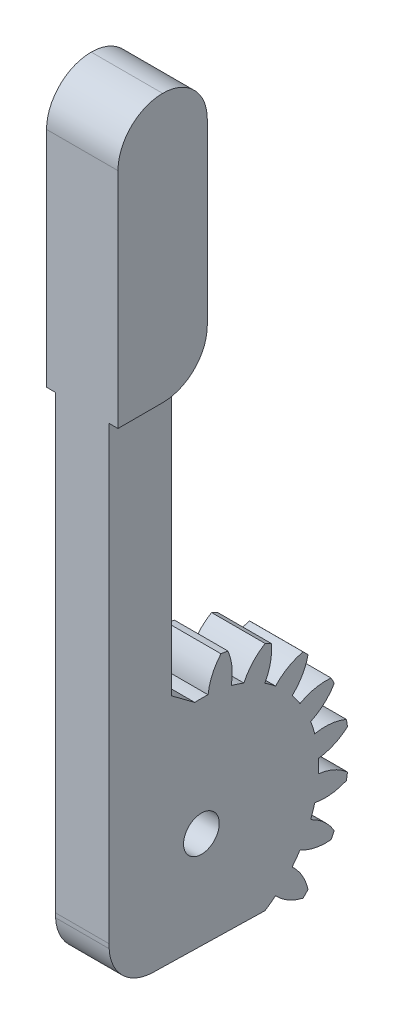
from build123d import *

# Parameters (mm, degrees)
BASPROSKE_W         = 6
BASPROSKE_H         = 16.5
TOOTHCUT_DEPTH      = 25.093567606
TEETHCUTS_COUNT     = 20
TEETHCUTS_ANGLE     = 342
BORSKE_R            = 2
BORE_DEPTH          = 50.0000508
SKETCH1_W           = 14.532002023
SKETCH1_H           = 35.225661126
CUT_EXTRUDE1_DEPTH  = 5
SKETCH3_W           = 7
SKETCH3_H           = 90
BOSS_EXTRUDE2_DEPTH = 3
SKETCH4_W           = 10
SKETCH4_H           = 30
BOSS_EXTRUDE3_DEPTH = 4
FILLET1_R           = 10
FILLET4_R           = 5
FILLET5_R           = 1
CUT_EXTRUDE4_DEPTH  = 4
CUT_EXTRUDE6_DEPTH  = 4
FILLET6_R           = 5


with BuildPart() as part:
    # BasProSke → Base-Revolve (revolve)
    with BuildSketch(Plane(origin=(0, 0, 0), x_dir=(1, 0, 0), z_dir=(0, 1, 0)), mode=Mode.PRIVATE) as base_revolve_sk:
        with Locations((3, 8.25)):
            Rectangle(BASPROSKE_W, BASPROSKE_H)
    revolve(base_revolve_sk.sketch.rotate(Axis((-10, 0, 0), (1, 0, 0)), 180), axis=Axis((-10, 0, 0), (1, 0, 0)))

    # TooCutSke → ToothCut (cut, through all)
    with BuildSketch(Plane(origin=(0, 0, 0), x_dir=(0, 0, -1), z_dir=(1, 0, 0))):
        with BuildLine():
            ThreePointArc((0.74381438, 13.102904875), (0, 13.124), (-0.74381438, 13.102904875))
            ThreePointArc((-0.74381438, 13.102904875), (-1.226473103, 14.852072512), (-2.209965745, 16.376962373))
            ThreePointArc((-2.209965745, 16.376962373), (0, 16.5254), (2.209965745, 16.376962373))
            ThreePointArc((2.209965745, 16.376962373), (1.226473103, 14.852072512), (0.74381438, 13.102904875))
        make_face()
    toothcut = extrude(amount=TOOTHCUT_DEPTH, mode=Mode.SUBTRACT)

    # TeethCuts: ToothCut ×20 about axis
    teethcuts_axis = Axis((-10, 0, 0), (1, 0, 0))
    for i in range(1, TEETHCUTS_COUNT):
        add(toothcut.rotate(teethcuts_axis, i * TEETHCUTS_ANGLE / (TEETHCUTS_COUNT - 1)), mode=Mode.SUBTRACT)

    # BorSke → Bore (cut, symmetric)
    with BuildSketch(Plane(origin=(0, 0, 0), x_dir=(0, 0, -1), z_dir=(1, 0, 0))):
        with Locations(Location((0, 0, 0), (0, 0, 180))):
            Circle(BORSKE_R)
    extrude(amount=BORE_DEPTH, both=True, mode=Mode.SUBTRACT)

    # Sketch1 → Cut-Extrude1 (cut, symmetric)
    with BuildSketch(Plane(origin=(3, 0, 0), x_dir=(0, 0, -1), z_dir=(1, 0, 0))):
        with Locations((-10.60761178, 0.822467031)):
            Rectangle(SKETCH1_W, SKETCH1_H)
    extrude(amount=CUT_EXTRUDE1_DEPTH, both=True, mode=Mode.SUBTRACT)

    # Sketch3 → Boss-Extrude2 (add, symmetric)
    with BuildSketch(Plane(origin=(3, 0, 0), x_dir=(0, 0, -1), z_dir=(1, 0, 0))):
        with Locations((-6.841610769, 29.963142125)):
            Rectangle(SKETCH3_W, SKETCH3_H)
    extrude(amount=BOSS_EXTRUDE2_DEPTH, both=True)

    # Sketch4 → Boss-Extrude3 (add, symmetric)
    with BuildSketch(Plane(origin=(3, 0, 0), x_dir=(0, 0, -1), z_dir=(1, 0, 0))):
        with Locations((-5.341610769, 59.963142125)):
            Rectangle(SKETCH4_W, SKETCH4_H)
    extrude(amount=BOSS_EXTRUDE3_DEPTH, both=True)

    # Fillet1
    # the kernel refuses this fillet: 10 mm, written as the material it takes off along each edge
    with BuildSketch(Plane(origin=(29.848480035, -15.036857875, 10.341610769), x_dir=(0, 0, -1), z_dir=(-1, 0, 0))) as fillet1_piece_1:
        with BuildLine():
            CenterArc((10, -9.539392014), FILLET1_R, 107.457603124, 72.542396876)
            Line((0, -9.539392014), (-0.2, -9.539392014))
            Line((-0.2, -9.539392014), (-0.2, 0))
            Line((-0.2, 0), (0, 0.2))
            ThreePointArc((0, 0.2), (3.5, 0.2), (6.94, 0.19078784))
            Line((6.94, 0.19078784), (7, 0))
        make_face()
    extrude(amount=53.696960071, mode=Mode.SUBTRACT)

    # Fillet4
    # the kernel refuses this fillet: 5 mm, written as the material it takes off along each edge
    with BuildSketch(Plane(origin=(19.5, 44.963142125, 0.341610769), x_dir=(0, 0, 1), z_dir=(-1, 0, 0))) as fillet4_piece_1_section:
        with BuildLine():
            CenterArc((FILLET4_R, FILLET4_R), FILLET4_R, 180, 90)
            Line((0, FILLET4_R), (0, 0))
            Line((0, 0), (FILLET4_R, 0))
        make_face()
    fillet4_piece_1 = extrude(amount=33, mode=Mode.PRIVATE)
    fillet4_piece_1 = split(fillet4_piece_1, bisect_by=Plane(origin=(12.75, 45.013801365, 3.341610769), z_dir=(0, 0, 1)), keep=Keep.TOP, mode=Mode.PRIVATE)
    fillet4_piece_1 = split(fillet4_piece_1, bisect_by=Plane(origin=(6, 45.013801365, 4.050354099), z_dir=(1, 0, 0)), keep=Keep.TOP, mode=Mode.PRIVATE)
    add(fillet4_piece_1, mode=Mode.SUBTRACT)
    with BuildSketch(Plane(origin=(19.5, 44.963142125, 0.341610769), x_dir=(0, 0, 1), z_dir=(-1, 0, 0))) as fillet4_piece_2_section:
        with BuildLine():
            CenterArc((FILLET4_R, FILLET4_R), FILLET4_R, 180, 90)
            Line((0, FILLET4_R), (0, 0))
            Line((0, 0), (FILLET4_R, 0))
        make_face()
    fillet4_piece_2 = extrude(amount=33, mode=Mode.PRIVATE)
    fillet4_piece_2 = split(fillet4_piece_2, bisect_by=Plane(origin=(12.75, 46.181868003, 3.341610769), z_dir=(0, 0, -1)), keep=Keep.TOP, mode=Mode.PRIVATE)
    fillet4_piece_2 = split(fillet4_piece_2, bisect_by=Plane(origin=(6, 46.181868003, 1.266861087), z_dir=(1, 0, 0)), keep=Keep.TOP, mode=Mode.PRIVATE)
    add(fillet4_piece_2, mode=Mode.SUBTRACT)
    with BuildSketch(Plane(origin=(19.5, 44.963142125, 0.341610769), x_dir=(0, 0, 1), z_dir=(-1, 0, 0))) as fillet4_piece_3_section:
        with BuildLine():
            CenterArc((FILLET4_R, FILLET4_R), FILLET4_R, 180, 90)
            Line((0, FILLET4_R), (0, 0))
            Line((0, 0), (FILLET4_R, 0))
        make_face()
    fillet4_piece_3 = extrude(amount=33, mode=Mode.PRIVATE)
    fillet4_piece_3 = split(fillet4_piece_3, bisect_by=Plane(origin=(0, 46.181868003, 1.266861087), z_dir=(1, 0, 0)), keep=Keep.TOP, mode=Mode.PRIVATE)
    fillet4_piece_3 = split(fillet4_piece_3, bisect_by=Plane(origin=(3, 46.181868003, 3.341610769), z_dir=(0, 0, -1)), keep=Keep.TOP, mode=Mode.PRIVATE)
    fillet4_piece_3 = split(fillet4_piece_3, bisect_by=Plane(origin=(6, 46.181868003, 1.266861087), z_dir=(-1, 0, 0)), keep=Keep.TOP, mode=Mode.PRIVATE)
    add(fillet4_piece_3, mode=Mode.SUBTRACT)
    with BuildSketch(Plane(origin=(19.5, 44.963142125, 0.341610769), x_dir=(0, 0, 1), z_dir=(-1, 0, 0))) as fillet4_piece_4_section:
        with BuildLine():
            CenterArc((FILLET4_R, FILLET4_R), FILLET4_R, 180, 90)
            Line((0, FILLET4_R), (0, 0))
            Line((0, 0), (FILLET4_R, 0))
        make_face()
    fillet4_piece_4 = extrude(amount=33, mode=Mode.PRIVATE)
    fillet4_piece_4 = split(fillet4_piece_4, bisect_by=Plane(origin=(0, 45.013801365, 4.050354099), z_dir=(-1, 0, 0)), keep=Keep.TOP, mode=Mode.PRIVATE)
    fillet4_piece_4 = split(fillet4_piece_4, bisect_by=Plane(origin=(-6.75, 45.013801365, 3.341610769), z_dir=(0, 0, 1)), keep=Keep.TOP, mode=Mode.PRIVATE)
    add(fillet4_piece_4, mode=Mode.SUBTRACT)
    with BuildSketch(Plane(origin=(19.5, 44.963142125, 0.341610769), x_dir=(0, 0, 1), z_dir=(-1, 0, 0))) as fillet4_piece_5_section:
        with BuildLine():
            CenterArc((FILLET4_R, FILLET4_R), FILLET4_R, 180, 90)
            Line((0, FILLET4_R), (0, 0))
            Line((0, 0), (FILLET4_R, 0))
        make_face()
    fillet4_piece_5 = extrude(amount=33, mode=Mode.PRIVATE)
    fillet4_piece_5 = split(fillet4_piece_5, bisect_by=Plane(origin=(0, 46.181868003, 1.266861087), z_dir=(-1, 0, 0)), keep=Keep.TOP, mode=Mode.PRIVATE)
    fillet4_piece_5 = split(fillet4_piece_5, bisect_by=Plane(origin=(-6.75, 46.181868003, 3.341610769), z_dir=(0, 0, -1)), keep=Keep.TOP, mode=Mode.PRIVATE)
    add(fillet4_piece_5, mode=Mode.SUBTRACT)
    with BuildSketch(Plane(origin=(19.5, 74.963142125, 10.341610769), x_dir=(0, -1, 0), z_dir=(-1, 0, 0))) as fillet4_piece_6:
        with BuildLine():
            CenterArc((FILLET4_R, -FILLET4_R), FILLET4_R, 90, 90)
            Line((0, -FILLET4_R), (0, 0))
            Line((0, 0), (FILLET4_R, 0))
        make_face()
    extrude(amount=33, mode=Mode.SUBTRACT)
    with BuildSketch(Plane(origin=(19.5, 74.963142125, 0.341610769), x_dir=(0, -1, 0), z_dir=(-1, 0, 0))) as fillet4_piece_7:
        with BuildLine():
            CenterArc((FILLET4_R, FILLET4_R), FILLET4_R, 180, 90)
            Line((0, FILLET4_R), (0, 0))
            Line((0, 0), (FILLET4_R, 0))
        make_face()
    extrude(amount=33, mode=Mode.SUBTRACT)

    # Fillet5
    fillet5_edges = [part.edges().sort_by_distance(p)[0] for p in [
        (3, 45.38056643, 3.341610769),
    ]]
    fillet(fillet5_edges, radius=FILLET5_R)

    # Sketch5 → Cut-Extrude4 (cut, symmetric)
    with BuildSketch(Plane(origin=(3, 0, 0), x_dir=(0, 0, -1), z_dir=(1, 0, 0))):
        Polygon((-0.646757919, 13.233276671), (-0.74381438, 13.102904875), (-3.341610769, 15.036857875), (-3.193884675, 16.241167121), (-1.325890901, 16.884807614), align=None)
    extrude(amount=CUT_EXTRUDE4_DEPTH, both=True, mode=Mode.SUBTRACT)

    # Sketch7 → Cut-Extrude6 (cut, symmetric)
    with BuildSketch(Plane(origin=(3, 0, 0), x_dir=(0, 0, -1), z_dir=(1, 0, 0))):
        Polygon((-7.363012022, -15.230284447), (-8.903180744, -10.664623645), (7.578586785, -11.037675843), (10.397777633, -17.422865984), (-4.980223066, -17.422865984), align=None)
    extrude(amount=CUT_EXTRUDE6_DEPTH, both=True, mode=Mode.SUBTRACT)

    # Fillet6
    fillet6_edges = [part.edges().sort_by_distance(p)[0] for p in [
        (3, -10.664623645, 8.903180744),
    ]]
    fillet(fillet6_edges, radius=FILLET6_R)


solid = part.part
